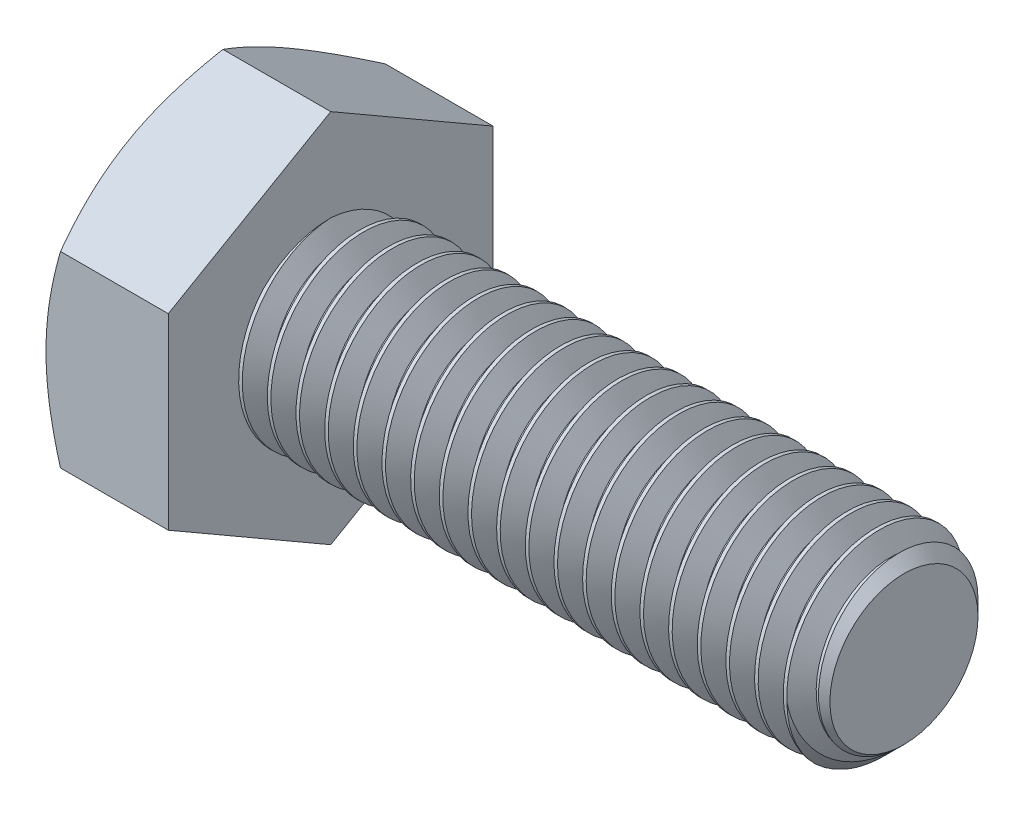
from build123d import *

# Parameters (mm, degrees)
SKETCH2_R           = 5
BOSS_EXTRUDE1_DEPTH = 30
CHAMFER1_SIZE       = 1.125
CUT_SWEEP1_PITCH    = 1.5
BOSS_EXTRUDE2_DEPTH = 6.4
SKETCH6_OUTSIDE_W   = 165.282
SKETCH6_OUTSIDE_H   = 167.912
SKETCH6_OUTSIDE_R   = 8.5
CUT_EXTRUDE1_DEPTH  = 39.646388502
CUT_EXTRUDE1_DRAFT  = -60


with BuildPart() as part:
    # Sketch2 → Boss-Extrude1 (new body)
    with BuildSketch(Plane(origin=(18.2, 0, 0), x_dir=(0, 0, -1), z_dir=(1, 0, 0))):
        Circle(SKETCH2_R)
    extrude(amount=-BOSS_EXTRUDE1_DEPTH)

    # Chamfer1
    chamfer1_edges = [part.edges().sort_by_distance(p)[0] for p in [
        (18.2, 0, 5),
    ]]
    chamfer(chamfer1_edges, length=CHAMFER1_SIZE)

    # Cut-Sweep1: the profile of Sketch5 profile screwed along a right-hand helix of 21 turns, 8 arcs to a turn; built about Z, then put on its axis
    cut_sweep1_z = Axis((0, 0, 0), (0, 0, 1))
    cut_sweep1_corners = [(5.0003, 0, 0.000173205), (4.025721421, 0, -0.5625), (4.025721421, 0, -0.75), (5.0003, 0, -1.312673205)]
    with BuildLine(mode=Mode.PRIVATE) as cut_sweep1_profile:
        Line(cut_sweep1_corners[0], cut_sweep1_corners[1])
        Line(cut_sweep1_corners[1], cut_sweep1_corners[2])
        Line(cut_sweep1_corners[2], cut_sweep1_corners[3])
        Line(cut_sweep1_corners[3], cut_sweep1_corners[0])
    cut_sweep1_cap = Face(cut_sweep1_profile.wire())
    cut_sweep1_turn_angles = [0, 22.5, 45, 67.5, 90, 112.5, 135, 157.5, 180, 202.5, 225, 247.5, 270, 292.5, 315, 337.5, 360]
    cut_sweep1_turn_weights = [1, 0.9238795325112867, 1, 0.9238795325112867, 1, 0.9238795325112867, 1, 0.9238795325112867, 1, 0.9238795325112867, 1, 0.9238795325112867, 1, 0.9238795325112867, 1, 0.9238795325112867, 1]
    cut_sweep1_turn_rails = [Edge.make_bspline([Vector(p[0], p[1], 0).rotate(cut_sweep1_z, cut_sweep1_turn_angles[k]) / cut_sweep1_turn_weights[k] + Vector(0, 0, p[2] + CUT_SWEEP1_PITCH * cut_sweep1_turn_angles[k] / 360) for k in range(17)], [0, 0, 0, 1, 1, 2, 2, 3, 3, 4, 4, 5, 5, 6, 6, 7, 7, 8, 8, 8], 2, cut_sweep1_turn_weights) for p in cut_sweep1_corners]
    cut_sweep1_turn_sides = [Face.make_surface_from_curves(cut_sweep1_turn_rails[p[0]], cut_sweep1_turn_rails[p[1]]) for p in [(0, 1), (1, 2), (2, 3), (3, 0)]]
    cut_sweep1 = Plane(origin=(18.2, 0, 0), x_dir=(0, 1, 0), z_dir=(-1, 0, 0)) * Solid(Shell([*[p.moved(Location((0, 0, CUT_SWEEP1_PITCH * i))) for i in range(21) for p in cut_sweep1_turn_sides], cut_sweep1_cap, cut_sweep1_cap.rotate(cut_sweep1_z, 7560).moved(Location((0, 0, CUT_SWEEP1_PITCH * 7560 / 360)))]))
    add(cut_sweep1, mode=Mode.SUBTRACT)

    # Sketch3 → Boss-Extrude2 (add)
    with BuildSketch(Plane.ZY.offset(11.8)):
        Polygon((-8.5, -4.907477288), (0, -9.814954576), (8.5, -4.907477288), (8.5, 4.907477288), (0, 9.814954576), (-8.5, 4.907477288), align=None)
    extrude(amount=BOSS_EXTRUDE2_DEPTH)


with BuildPart() as cut_extrude1_tool:
    # Sketch6 outside → Cut-Extrude1 (with draft: the straight prism first)
    with BuildSketch(Plane.ZY.offset(18.2)):
        Rectangle(SKETCH6_OUTSIDE_W, SKETCH6_OUTSIDE_H)
        Circle(SKETCH6_OUTSIDE_R, mode=Mode.SUBTRACT)
    extrude(amount=-CUT_EXTRUDE1_DEPTH)
    # Cut-Extrude1: the draft: its side faces are tilted about the plane it starts from
    cut_extrude1_sides = [cut_extrude1_tool.faces().sort_by_distance(p)[0] for p in [
        (1.623194251, -83.956, 0),
        (1.623194251, 0, 82.641),
        (1.623194251, 83.956, 0),
        (1.623194251, 0, -82.641),
        (1.623194251, 0, -8.5),
    ]]
    draft(cut_extrude1_sides, Plane.ZY.offset(18.2), CUT_EXTRUDE1_DRAFT)


with BuildPart() as part_1:
    add(part.part)

    # Cut-Extrude1: cut by cut_extrude1_tool
    add(cut_extrude1_tool.part, mode=Mode.SUBTRACT)


solid = part_1.part
